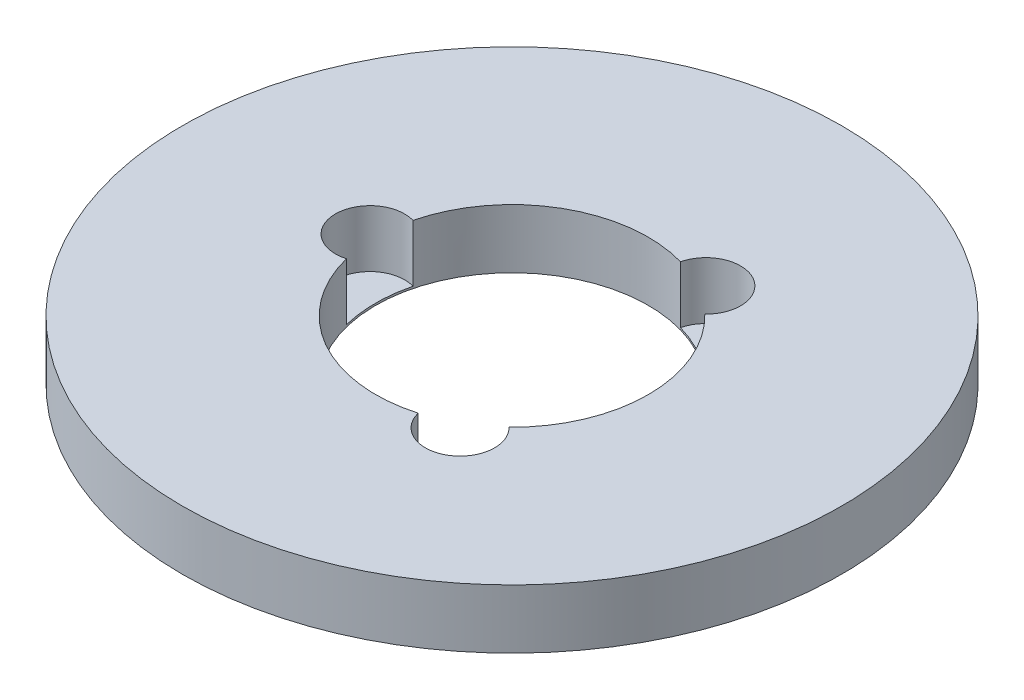
from build123d import *

# Parameters (mm, degrees)
SKETCH1_R           = 72.5
BOSS_EXTRUDE1_DEPTH = 13
SKETCH2_R           = 30
CUT_EXTRUDE1_DEPTH  = 104.351342517
SKETCH3_R           = 7.618751991
CUT_EXTRUDE2_DEPTH  = 12.556649537
CIRPATTERN1_COUNT   = 3


with BuildPart() as part:
    # Sketch1 → Boss-Extrude1 (new body)
    with BuildSketch(Plane(origin=(0, 0, 0), x_dir=(1, 0, 0), z_dir=(0, 1, 0))):
        Circle(SKETCH1_R)
    extrude(amount=BOSS_EXTRUDE1_DEPTH)

    # Sketch2 → Cut-Extrude1 (cut, through all)
    with BuildSketch(Plane(origin=(0, 0, 0), x_dir=(1, 0, 0), z_dir=(0, 1, 0))):
        Circle(SKETCH2_R)
    extrude(amount=CUT_EXTRUDE1_DEPTH, mode=Mode.SUBTRACT)

    # Sketch3 → Cut-Extrude2 (cut)
    with BuildSketch(Plane(origin=(0, 13, 0), x_dir=(1, 0, 0), z_dir=(0, 1, 0))):
        with Locations((-31.234649967, 0)):
            Circle(SKETCH3_R)
    cut_extrude2 = extrude(amount=-CUT_EXTRUDE2_DEPTH, mode=Mode.SUBTRACT)

    # CirPattern1: Cut-Extrude2 ×3 about axis
    cirpattern1_axis = Axis((0, 0, 0), (0, 1, 0))
    for i in range(1, CIRPATTERN1_COUNT):
        add(cut_extrude2.rotate(cirpattern1_axis, i * 360 / CIRPATTERN1_COUNT), mode=Mode.SUBTRACT)


solid = part.part
